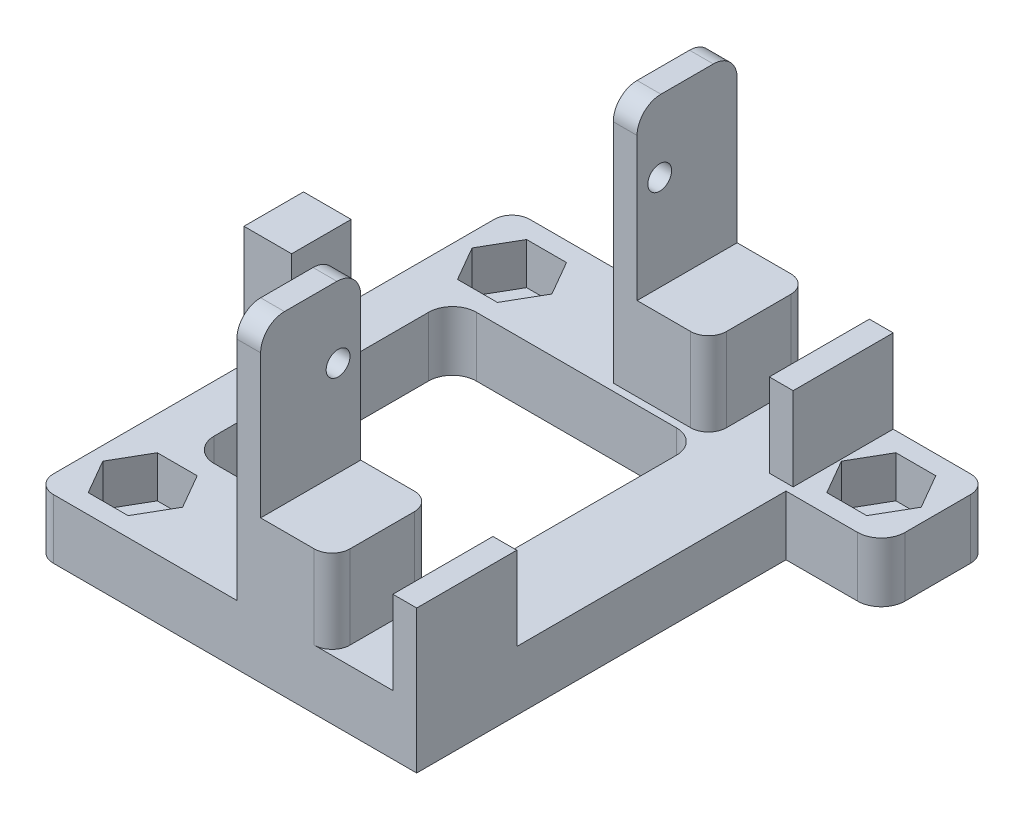
from build123d import *

# Parameters (mm, degrees)
ESQUISSE1_R                  = 11.75
BOSS_EXTRU_1_DEPTH           = 0.0001
ESQUISSE2_W                  = 40
ESQUISSE2_H                  = 40
BOSS_EXTRU_2_DEPTH           = 5
ENL_V_MAT_EXTRU_1_DEPTH      = 3.5
ESQUISSE4_R                  = 1.75
ENL_V_MAT_EXTRU_2_DEPTH      = 2
ESQUISSE5_W                  = 2
ESQUISSE5_H                  = 40
ESQUISSE5_W_2                = 8
BOSS_EXTRU_3_DEPTH           = 7
ESQUISSE6_W                  = 2
ESQUISSE6_H                  = 40
BOSS_EXTRU_4_DEPTH           = 14
ENL_V_MAT_EXTRU_3_DEPTH      = 14
ENL_V_MAT_EXTRU_3_DEPTH_BACK = 14
ESQUISSE7_R                  = 1
CONG_1_R                     = 2
CONG_2_R                     = 1.5
CONG_3_R                     = 1.5
ESQUISSE10_W                 = 8
ESQUISSE10_H                 = 31
ENL_V_MAT_EXTRU_4_DEPTH      = 10
CONG_4_R                     = 2
ESQUISSE11_W                 = 20.8
ESQUISSE11_H                 = 22
ENL_V_MAT_EXTRU_5_DEPTH      = 10
CONG_5_R                     = 2
ESQUISSE12_W                 = 4
ESQUISSE12_H                 = 5
BOSS_EXTRU_5_DEPTH           = 10


with BuildPart() as part:
    # Esquisse1 → Boss.-Extru.1 (new body)
    with BuildSketch(Plane(origin=(0, 0, 0), x_dir=(1, 0, 0), z_dir=(0, 1, 0))):
        with Locations(Location((0, 0, 0), (0, 0, 270))):
            Circle(ESQUISSE1_R)
    extrude(amount=BOSS_EXTRU_1_DEPTH)

    # Esquisse2 → Boss.-Extru.2 (add)
    with BuildSketch(Plane(origin=(0, 0.0001, 0), x_dir=(1, 0, 0), z_dir=(0, 1, 0))):
        Rectangle(ESQUISSE2_W, ESQUISSE2_H)
    extrude(amount=BOSS_EXTRU_2_DEPTH)

    # Esquisse3 → Enlèv. mat.-Extru.1 (cut)
    with BuildSketch(Plane(origin=(0, 5.0001, 0), x_dir=(1, 0, 0), z_dir=(0, 1, 0))):
        Polygon((-13.825684219, 12.6), (-12.151368439, 15.5), (-13.825684219, 18.4), (-17.174315781, 18.4), (-18.848631561, 15.5), (-17.174315781, 12.6), align=None)
        Polygon((-18.848631561, -15.5), (-17.174315781, -18.4), (-13.825684219, -18.4), (-12.151368439, -15.5), (-13.825684219, -12.6), (-17.174315781, -12.6), align=None)
        Polygon((12.151368439, -15.5), (13.825684219, -18.4), (17.174315781, -18.4), (18.848631561, -15.5), (17.174315781, -12.6), (13.825684219, -12.6), align=None)
        Polygon((13.825684219, 12.6), (17.174315781, 12.6), (18.848631561, 15.5), (17.174315781, 18.4), (13.825684219, 18.4), (12.151368439, 15.5), align=None)
    extrude(amount=-ENL_V_MAT_EXTRU_1_DEPTH, mode=Mode.SUBTRACT)

    # Esquisse4 → Enlèv. mat.-Extru.2 (cut)
    with BuildSketch(Plane(origin=(0, 1.5001, 0), x_dir=(1, 0, 0), z_dir=(0, 1, 0))):
        with Locations(Location((-15.5, 15.5, 0), (0, 0, 270))):
            Circle(ESQUISSE4_R)
        with Locations(Location((15.5, 15.5, 0), (0, 0, 270))):
            Circle(ESQUISSE4_R)
        with Locations(Location((-15.5, -15.5, 0), (0, 0, 270))):
            Circle(ESQUISSE4_R)
        with Locations(Location((15.5, -15.5, 0), (0, 0, 270))):
            Circle(ESQUISSE4_R)
    extrude(amount=-ENL_V_MAT_EXTRU_2_DEPTH, mode=Mode.SUBTRACT)

    # Esquisse5 → Boss.-Extru.3 (add)
    with BuildSketch(Plane(origin=(0, 5.0001, 0), x_dir=(1, 0, 0), z_dir=(0, 1, 0))):
        with Locations((11, 0)):
            Rectangle(ESQUISSE5_W, ESQUISSE5_H)
        with Locations((0.9, 0)):
            Rectangle(ESQUISSE5_W_2, ESQUISSE5_H)
    extrude(amount=BOSS_EXTRU_3_DEPTH)

    # Esquisse6 → Boss.-Extru.4 (add)
    with BuildSketch(Plane(origin=(0, 12.0001, 0), x_dir=(1, 0, 0), z_dir=(0, 1, 0))):
        with Locations((-2.1, 0)):
            Rectangle(ESQUISSE6_W, ESQUISSE6_H)
    extrude(amount=BOSS_EXTRU_4_DEPTH)

    # Esquisse7 → Enlèv. mat.-Extru.3 (cut, two sides: drawn at the far end of the back side and taken through both)
    with BuildSketch(Plane(origin=(-1.1, 0, 0), x_dir=(0, 0, -1), z_dir=(1, 0, 0)).offset(-ENL_V_MAT_EXTRU_3_DEPTH_BACK)):
        with Locations(Location((-13.5, 20.0001, 0), (0, 0, 180))):
            Circle(ESQUISSE7_R)
        with Locations(Location((13.5, 20.0001, 0), (0, 0, 180))):
            Circle(ESQUISSE7_R)
        Polygon((0, 26.0001), (-11.6, 26.0001), (-11.6, 5.0001), (11.6, 5.0001), (11.6, 26.0001), align=None)
    extrude(amount=ENL_V_MAT_EXTRU_3_DEPTH + ENL_V_MAT_EXTRU_3_DEPTH_BACK, mode=Mode.SUBTRACT)

    # Congé1
    cong_1_edges = [part.edges().sort_by_distance(p)[0] for p in [
        (-2.1, 26.0001, 20),
        (-2.1, 26.0001, -20),
        (-2.1, 26.0001, 11.6),
        (-2.1, 26.0001, -11.6),
    ]]
    fillet(cong_1_edges, radius=CONG_1_R)

    # Congé2
    cong_2_edges = [part.edges().sort_by_distance(p)[0] for p in [
        (4.9, 8.5001, 20),
        (4.9, 8.5001, -20),
        (4.9, 8.5001, -11.6),
        (4.9, 8.5001, 11.6),
    ]]
    fillet(cong_2_edges, radius=CONG_2_R)

    # Congé3
    cong_3_edges = [part.edges().sort_by_distance(p)[0] for p in [
        (20, 2.5001, 20),
        (20, 2.5001, -20),
        (-20, 2.5001, -20),
        (-20, 2.5001, 20),
    ]]
    fillet(cong_3_edges, radius=CONG_3_R)

    # Esquisse10 → Enlèv. mat.-Extru.4 (cut)
    with BuildSketch(Plane(origin=(0, 5.0001, 0), x_dir=(1, 0, 0), z_dir=(0, 1, 0))):
        with Locations((16, -4.5)):
            Rectangle(ESQUISSE10_W, ESQUISSE10_H)
    extrude(amount=-ENL_V_MAT_EXTRU_4_DEPTH, mode=Mode.SUBTRACT)

    # Congé4
    cong_4_edges = [part.edges().sort_by_distance(p)[0] for p in [
        (20, 2.5001, -11),
    ]]
    fillet(cong_4_edges, radius=CONG_4_R)

    # Esquisse11 → Enlèv. mat.-Extru.5 (cut)
    with BuildSketch(Plane(origin=(0, 5.0001, 0), x_dir=(1, 0, 0), z_dir=(0, 1, 0))):
        with Locations((-5.6, 0)):
            Rectangle(ESQUISSE11_W, ESQUISSE11_H)
    extrude(amount=-ENL_V_MAT_EXTRU_5_DEPTH, mode=Mode.SUBTRACT)

    # Congé5
    # the kernel refuses this fillet: 2 mm, written as the material it adds along each edge
    with BuildSketch(Plane(origin=(4.8, 5.0001, 11), x_dir=(0, 0, -1), z_dir=(0, -1, 0))) as cong_5_piece_1_section:
        with BuildLine():
            CenterArc((CONG_5_R, -CONG_5_R), CONG_5_R, 90, 90)
            Line((0, -CONG_5_R), (0, 0))
            Line((0, 0), (CONG_5_R, 0))
        make_face()
    cong_5_piece_1 = extrude(amount=10, mode=Mode.PRIVATE)
    cong_5_piece_1 = split(cong_5_piece_1, bisect_by=Plane(origin=(4.313925052, 0, 10.490530882), z_dir=(0, 1, 0)), keep=Keep.TOP, mode=Mode.PRIVATE)
    add(cong_5_piece_1)
    with BuildSketch(Plane(origin=(-16, 5.0001, 11), x_dir=(0, 0, -1), z_dir=(0, -1, 0))) as cong_5_piece_2:
        with BuildLine():
            CenterArc((CONG_5_R, CONG_5_R), CONG_5_R, 180, 90)
            Line((0, CONG_5_R), (0, 0))
            Line((0, 0), (CONG_5_R, 0))
        make_face()
    extrude(amount=5)
    with BuildSketch(Plane(origin=(4.8, 5.0001, -11), x_dir=(-1, 0, 0), z_dir=(0, -1, 0))) as cong_5_piece_3_section:
        with BuildLine():
            CenterArc((CONG_5_R, -CONG_5_R), CONG_5_R, 90, 90)
            Line((0, -CONG_5_R), (0, 0))
            Line((0, 0), (CONG_5_R, 0))
        make_face()
    cong_5_piece_3 = extrude(amount=10, mode=Mode.PRIVATE)
    cong_5_piece_3 = split(cong_5_piece_3, bisect_by=Plane(origin=(4.313925052, 0, -10.490530882), z_dir=(0, 1, 0)), keep=Keep.TOP, mode=Mode.PRIVATE)
    add(cong_5_piece_3)
    with BuildSketch(Plane(origin=(-16, 5.0001, -11), x_dir=(0, 0, 1), z_dir=(0, -1, 0))) as cong_5_piece_4:
        with BuildLine():
            CenterArc((CONG_5_R, -CONG_5_R), CONG_5_R, 90, 90)
            Line((0, -CONG_5_R), (0, 0))
            Line((0, 0), (CONG_5_R, 0))
        make_face()
    extrude(amount=5)

    # Esquisse12 → Boss.-Extru.5 (add)
    with BuildSketch(Plane(origin=(0, 5.0001, 0), x_dir=(1, 0, 0), z_dir=(0, 1, 0))):
        with Locations((-18, 0)):
            Rectangle(ESQUISSE12_W, ESQUISSE12_H)
    extrude(amount=BOSS_EXTRU_5_DEPTH)


solid = part.part
